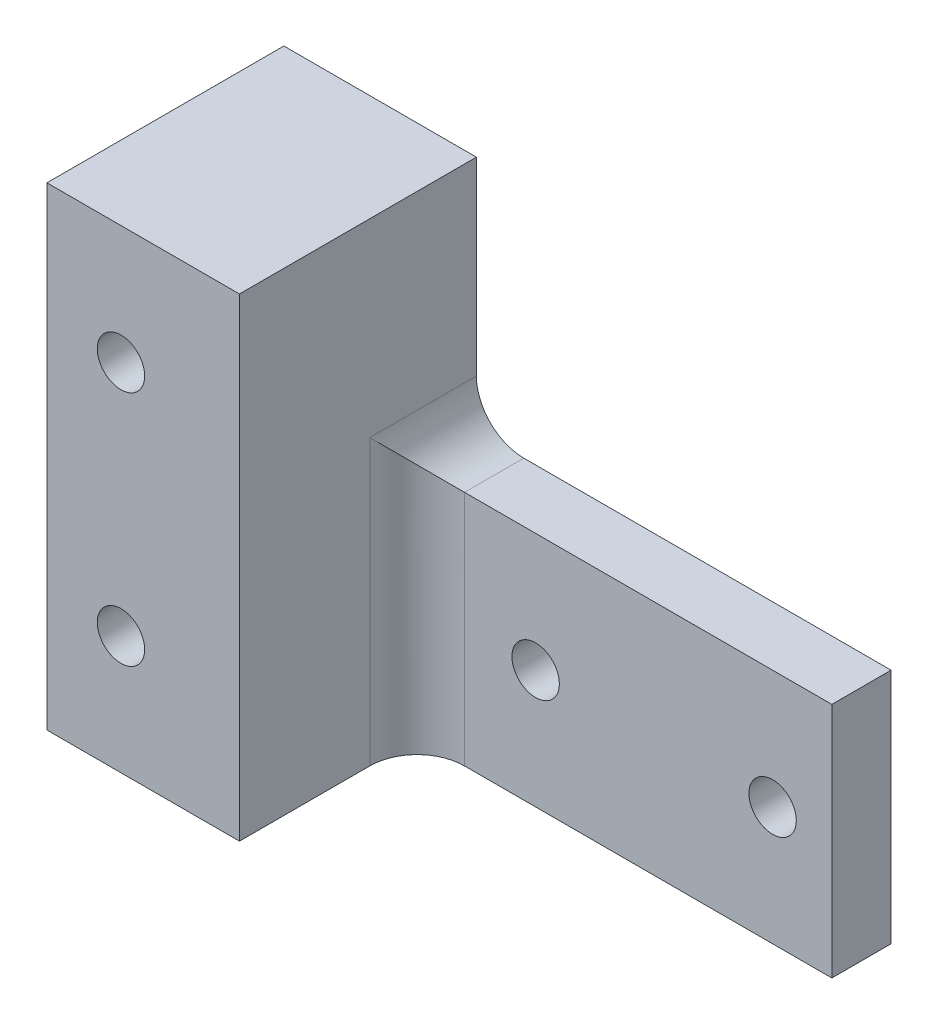
from build123d import *

# Parameters (mm, degrees)
BOSS_EXTRUDE1_DEPTH = 25.4
SKETCH2_R           = 2.54
CUT_EXTRUDE1_DEPTH  = 91.02678768
SKETCH3_W           = 4.7625
SKETCH3_H           = 50.8
CUT_EXTRUDE2_DEPTH  = 91.02678768
SKETCH4_W           = 44.45
SKETCH4_H           = 19.05
CUT_EXTRUDE3_DEPTH  = 91.02678768
FILLET1_R           = 5.08
SKETCH6_R           = 6.35
CUT_EXTRUDE5_DEPTH  = 12.7


with BuildPart() as part:
    # Sketch1 → Boss-Extrude1 (new body)
    with BuildSketch(Plane.XY):
        Polygon((0, 0), (0, 50.8), (25.4, 50.8), (25.4, 25.4), (69.85, 25.4), (69.85, 0), align=None)
    extrude(amount=BOSS_EXTRUDE1_DEPTH)

    # Sketch2 → Cut-Extrude1 (cut, through all)
    with BuildSketch(Plane.XY.offset(25.4)):
        with Locations((12.7, 38.1)):
            Circle(SKETCH2_R)
        with Locations((12.7, 12.7)):
            Circle(SKETCH2_R)
        with Locations((38.1, 12.7)):
            Circle(SKETCH2_R)
        with Locations((63.5, 12.7)):
            Circle(SKETCH2_R)
    extrude(amount=-CUT_EXTRUDE1_DEPTH, mode=Mode.SUBTRACT)

    # Sketch3 → Cut-Extrude2 (cut, through all)
    with BuildSketch(Plane.XY.offset(25.4)):
        with Locations((2.38125, 25.4)):
            Rectangle(SKETCH3_W, SKETCH3_H)
    extrude(amount=-CUT_EXTRUDE2_DEPTH, mode=Mode.SUBTRACT)

    # Sketch4 → Cut-Extrude3 (cut, through all)
    with BuildSketch(Plane.XZ):
        with Locations((47.625, 15.875)):
            Rectangle(SKETCH4_W, SKETCH4_H)
    extrude(amount=-CUT_EXTRUDE3_DEPTH, mode=Mode.SUBTRACT)

    # Fillet1
    fillet1_edges = [part.edges().sort_by_distance(p)[0] for p in [
        (25.4, 25.4, 3.175),
        (25.4, 12.7, 6.35),
    ]]
    fillet(fillet1_edges, radius=FILLET1_R)

    # Sketch6 → Cut-Extrude5 (cut)
    with BuildSketch(Plane(origin=(0, 0, 0), x_dir=(-1, 0, 0), z_dir=(0, 0, -1))):
        with Locations((-12.7, 38.1)):
            Circle(SKETCH6_R)
    extrude(amount=-CUT_EXTRUDE5_DEPTH, mode=Mode.SUBTRACT)


solid = part.part
